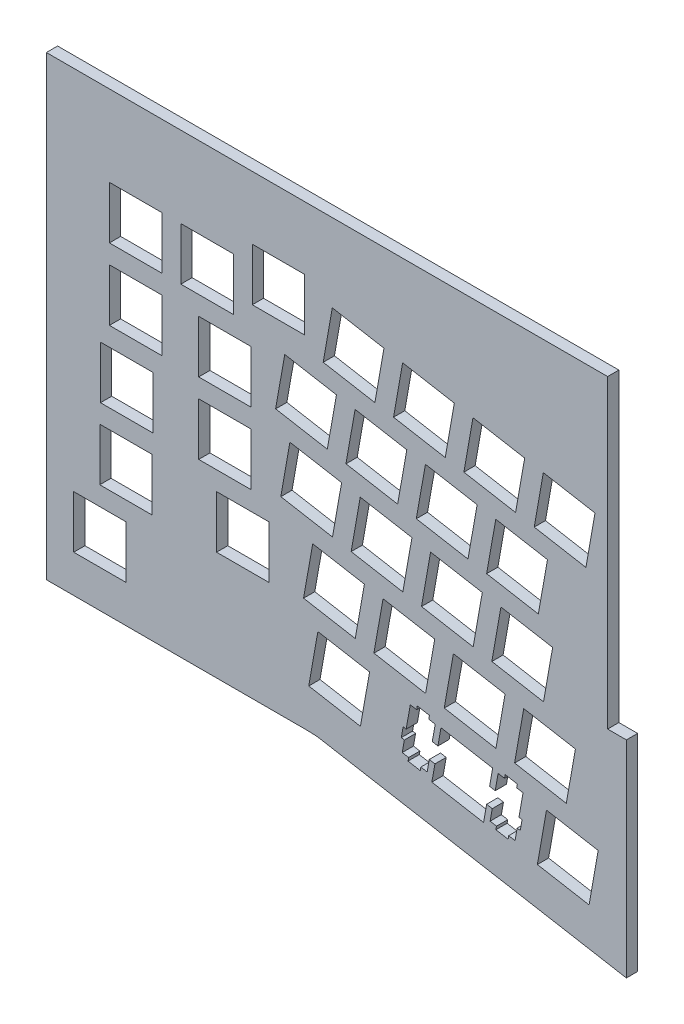
from build123d import *

# Parameters (mm, degrees)
RESSALTO_EXTRUS_O1_OUTLINE_W    = 385.763002014
RESSALTO_EXTRUS_O1_OUTLINE_H    = 172.784175795
RESSALTO_EXTRUS_O1_OUTLINE_W_2  = 13.999553143
RESSALTO_EXTRUS_O1_OUTLINE_H_2  = 14.000893144
RESSALTO_EXTRUS_O1_OUTLINE_W_3  = 13.999543143
RESSALTO_EXTRUS_O1_OUTLINE_H_3  = 14.000703143
RESSALTO_EXTRUS_O1_OUTLINE_W_4  = 13.998003143
RESSALTO_EXTRUS_O1_OUTLINE_W_5  = 14.000003143
RESSALTO_EXTRUS_O1_OUTLINE_W_6  = 14.000003144
RESSALTO_EXTRUS_O1_OUTLINE_W_7  = 13.999503143
RESSALTO_EXTRUS_O1_OUTLINE_H_4  = 13.999303143
RESSALTO_EXTRUS_O1_OUTLINE_H_5  = 13.999103143
RESSALTO_EXTRUS_O1_OUTLINE_W_8  = 13.999303144
RESSALTO_EXTRUS_O1_OUTLINE_W_9  = 13.999303143
RESSALTO_EXTRUS_O1_OUTLINE_W_10 = 13.999403143
RESSALTO_EXTRUS_O1_OUTLINE_H_6  = 13.999003143
RESSALTO_EXTRUS_O1_OUTLINE_H_7  = 14.000003143
RESSALTO_EXTRUS_O1_OUTLINE_W_11 = 14.001003144
RESSALTO_EXTRUS_O1_OUTLINE_W_12 = 13.999003143
RESSALTO_EXTRUS_O1_OUTLINE_H_8  = 14.000003144
RESSALTO_EXTRUS_O1_OUTLINE_W_13 = 13.999003144
RESSALTO_EXTRUS_O1_DEPTH        = 3
CORTE_EXTRUS_O1_DEPTH           = 3
CORTE_EXTRUS_O2_DEPTH           = 3


# Read off the part's stored shape, not the designer's step: Ressalto-extrusão1
with BuildPart() as part:
    # Ressalto-extrusão1 outline → Ressalto-extrusão1 (new body)
    with BuildSketch(Plane.XY):
        with Locations((-32.928151592, -125.295959232)):
            Rectangle(RESSALTO_EXTRUS_O1_OUTLINE_W, RESSALTO_EXTRUS_O1_OUTLINE_H)
        with Locations((-216.285310061, -202.161652991)):
            Rectangle(RESSALTO_EXTRUS_O1_OUTLINE_W_2, RESSALTO_EXTRUS_O1_OUTLINE_H_2, mode=Mode.SUBTRACT)
        with Locations((-211.522803992, -143.677644859)):
            Rectangle(RESSALTO_EXTRUS_O1_OUTLINE_W_3, RESSALTO_EXTRUS_O1_OUTLINE_H_3, mode=Mode.SUBTRACT)
        Polygon((-142.042718391, -152.663796877), (-155.830021487, -150.233196332), (-153.399320941, -136.447293236), (-139.610717845, -138.877993782), align=None, mode=Mode.SUBTRACT)
        Polygon((-124.664714489, -136.385193222), (-138.451817585, -133.954192677), (-136.020817039, -120.166989581), (-122.233713943, -122.597990127), align=None, mode=Mode.SUBTRACT)
        Polygon((-128.757115408, -141.024994264), (-127.058115027, -141.324094331), (-126.888414988, -140.359294115), (-123.637714259, -140.932494243), (-123.808714297, -141.89739446), (-122.109713916, -142.197594527), (-122.88671409, -146.599195516), (-121.384713753, -146.865195575), (-120.56871357, -142.234994536), (-106.779710474, -144.666995082), (-107.595710657, -149.295796121), (-106.09571032, -149.560396181), (-105.317710145, -145.157795192), (-103.620709764, -145.457995259), (-103.449709726, -144.492095043), (-100.199708996, -145.065295171), (-100.369709034, -146.030195388), (-98.671708653, -146.330395455), (-99.760708898, -152.503996841), (-98.947708715, -152.648596874), (-99.433708824, -155.404897493), (-100.245709006, -155.262697461), (-100.807709133, -158.443398175), (-102.506709514, -158.143198108), (-102.66570955, -159.049798311), (-105.914710279, -158.476498182), (-105.756710244, -157.570897979), (-107.453710625, -157.272097912), (-106.893710499, -154.090097198), (-108.394710836, -153.825497138), (-109.210711019, -158.452898177), (-122.999714115, -156.022197631), (-122.182713932, -151.394896592), (-123.684714269, -151.130296533), (-124.245714395, -154.310597247), (-125.944414777, -154.01039718), (-126.104614812, -154.916997383), (-129.353715542, -154.343697255), (-129.193815506, -153.437097051), (-130.893215888, -153.137896984), (-130.332315762, -149.95729627), (-131.144015944, -149.814096237), (-130.658915835, -147.056795618), (-129.845815652, -147.199995651), align=None, mode=Mode.SUBTRACT)
        Polygon((-81.071704701, -163.415399291), (-94.858707797, -160.984398746), (-92.426707251, -147.19719565), (-78.639704155, -149.628196196), align=None, mode=Mode.SUBTRACT)
        Polygon((-25.135692142, -144.336495008), (-25.293692178, -143.430894804), (-22.044691448, -142.857594676), (-21.884691412, -143.763194879), (-20.185691031, -143.464094812), (-19.624690905, -146.644695526), (-18.813690723, -146.501495494), (-18.326690613, -149.258796113), (-19.139690796, -149.401996145), (-18.049690551, -155.576997531), (-19.748690933, -155.876197599), (-19.579690895, -156.842097815), (-22.828691624, -157.413997944), (-22.999691663, -156.449497727), (-24.698692044, -156.748297794), (-25.474692218, -152.346996806), (-26.976692556, -152.611596866), (-26.160692372, -157.240397905), (-39.946695468, -159.671398451), (-40.763695651, -155.042197411), (-42.264695988, -155.306797471), (-41.488695814, -159.709798459), (-43.187696195, -160.008998527), (-43.016696157, -160.974898743), (-46.267696887, -161.548198872), (-46.436696925, -160.582298655), (-48.136697307, -160.881098722), (-49.224697551, -154.707397336), (-50.036697733, -154.850697368), (-50.524697843, -152.091996749), (-49.71169766, -151.950096717), (-50.272697786, -148.768096003), (-48.572697404, -148.469295936), (-48.73269744, -147.563695732), (-45.483696711, -146.990395603), (-45.323696675, -147.895995807), (-43.624696294, -147.59689574), (-43.063696168, -150.777496454), (-41.56169583, -150.512896394), (-42.377696014, -145.884095355), (-28.591692918, -143.453094809), (-27.775692735, -148.081895849), (-26.273692398, -147.815895789), (-26.834692524, -144.635295075), align=None, mode=Mode.SUBTRACT)
        Polygon((-105.903710277, -139.693893965), (-119.690713372, -137.262893419), (-117.259712827, -123.474290324), (-103.472709731, -125.90669087), align=None, mode=Mode.SUBTRACT)
        Polygon((-87.142706064, -143.001194708), (-100.93070916, -140.570194162), (-98.499708614, -126.782991066), (-84.712705519, -129.213991612), align=None, mode=Mode.SUBTRACT)
        Polygon((-50.356697805, -141.775994433), (-52.786698351, -127.988791337), (-38.999695255, -125.557790791), (-36.569694709, -139.344993887), align=None, mode=Mode.SUBTRACT)
        with Locations((150.428347277, -202.161652991)):
            Rectangle(RESSALTO_EXTRUS_O1_OUTLINE_W_4, RESSALTO_EXTRUS_O1_OUTLINE_H_2, mode=Mode.SUBTRACT)
        Polygon((-1.019686728, -152.80739691), (-3.450687273, -139.019793814), (10.338315823, -136.589093268), (12.769316368, -150.376396364), align=None, mode=Mode.SUBTRACT)
        Polygon((-31.595693593, -138.46869369), (-34.026694139, -124.680090594), (-20.239691043, -122.249090048), (-17.808690497, -136.036293144), align=None, mode=Mode.SUBTRACT)
        Polygon((-12.83468938, -135.159992947), (-15.265689926, -121.372789852), (-1.478686831, -118.941789306), (0.952313715, -132.727992401), align=None, mode=Mode.SUBTRACT)
        with Locations((74.227330168, -143.677644859)):
            Rectangle(RESSALTO_EXTRUS_O1_OUTLINE_W_5, RESSALTO_EXTRUS_O1_OUTLINE_H_3, mode=Mode.SUBTRACT)
        with Locations((93.277334445, -143.677644859)):
            Rectangle(RESSALTO_EXTRUS_O1_OUTLINE_W_5, RESSALTO_EXTRUS_O1_OUTLINE_H_3, mode=Mode.SUBTRACT)
        with Locations((112.327338722, -143.677644859)):
            Rectangle(RESSALTO_EXTRUS_O1_OUTLINE_W_6, RESSALTO_EXTRUS_O1_OUTLINE_H_3, mode=Mode.SUBTRACT)
        with Locations((-204.570682431, -124.628340583)):
            Rectangle(RESSALTO_EXTRUS_O1_OUTLINE_W_7, RESSALTO_EXTRUS_O1_OUTLINE_H_4, mode=Mode.SUBTRACT)
        with Locations((-204.379082388, -105.578436306)):
            Rectangle(RESSALTO_EXTRUS_O1_OUTLINE_W_7, RESSALTO_EXTRUS_O1_OUTLINE_H_5, mode=Mode.SUBTRACT)
        with Locations((-178.185376506, -105.578436306)):
            Rectangle(RESSALTO_EXTRUS_O1_OUTLINE_W_8, RESSALTO_EXTRUS_O1_OUTLINE_H_5, mode=Mode.SUBTRACT)
        with Locations((-173.422875437, -124.628340583)):
            Rectangle(RESSALTO_EXTRUS_O1_OUTLINE_W_9, RESSALTO_EXTRUS_O1_OUTLINE_H_4, mode=Mode.SUBTRACT)
        Polygon((-143.424918701, -133.07789248), (-157.212221797, -130.646891934), (-154.781521251, -116.859688838), (-140.994318156, -119.290689384), align=None, mode=Mode.SUBTRACT)
        Polygon((-149.496620065, -112.662287896), (-163.28382316, -110.23088735), (-160.853222614, -96.443884254), (-147.065919519, -98.8748848), align=None, mode=Mode.SUBTRACT)
        Polygon((-130.735815852, -115.970988639), (-144.524518948, -113.539988093), (-142.093918403, -99.752884997), (-128.305215307, -102.183885543), align=None, mode=Mode.SUBTRACT)
        with Locations((-201.997831853, -86.528382029)):
            Rectangle(RESSALTO_EXTRUS_O1_OUTLINE_W_10, RESSALTO_EXTRUS_O1_OUTLINE_H_6, mode=Mode.SUBTRACT)
        with Locations((-178.185376506, -86.528382029)):
            Rectangle(RESSALTO_EXTRUS_O1_OUTLINE_W_8, RESSALTO_EXTRUS_O1_OUTLINE_H_6, mode=Mode.SUBTRACT)
        Polygon((-150.878720375, -93.075883498), (-164.666023471, -90.643882952), (-162.235422925, -76.856879857), (-148.447819829, -79.287880402), align=None, mode=Mode.SUBTRACT)
        Polygon((-132.118016163, -96.383884241), (-145.906719259, -93.952883695), (-143.474618713, -80.163880599), (-129.687415617, -82.595881145), align=None, mode=Mode.SUBTRACT)
        Polygon((-111.97671164, -119.278289381), (-125.762714736, -116.847288836), (-123.33171419, -103.05988574), (-109.544711094, -105.490886286), align=None, mode=Mode.SUBTRACT)
        Polygon((-93.214707428, -122.586690124), (-107.001710523, -120.155989578), (-104.570709978, -106.368886483), (-90.783706882, -108.799887029), align=None, mode=Mode.SUBTRACT)
        Polygon((-58.354699601, -123.842190406), (-60.785700147, -110.05488731), (-46.997697051, -107.623886765), (-44.567696505, -121.41118986), align=None, mode=Mode.SUBTRACT)
        Polygon((-39.593695388, -120.534889664), (-42.024695934, -106.747886568), (-28.237692839, -104.316886022), (-25.806692293, -118.103889118), align=None, mode=Mode.SUBTRACT)
        Polygon((-94.596707738, -102.998885726), (-108.385710834, -100.568885181), (-105.953710288, -86.779882085), (-92.165707192, -89.211882631), align=None, mode=Mode.SUBTRACT)
        Polygon((-113.35771195, -99.691884984), (-127.144915046, -97.259884438), (-124.7137145, -83.472881342), (-110.926711405, -85.903881888), align=None, mode=Mode.SUBTRACT)
        Polygon((-66.352701397, -105.90888638), (-68.783701942, -92.120883284), (-54.996698847, -89.689882738), (-52.565698301, -103.477885834), align=None, mode=Mode.SUBTRACT)
        Polygon((-47.591697184, -102.600885637), (-50.02269773, -88.813882541), (-36.235694634, -86.382881995), (-33.804694089, -100.168885091), align=None, mode=Mode.SUBTRACT)
        with Locations((-201.997831853, -67.478377751)):
            Rectangle(RESSALTO_EXTRUS_O1_OUTLINE_W_10, RESSALTO_EXTRUS_O1_OUTLINE_H_6, mode=Mode.SUBTRACT)
        with Locations((-182.947877576, -67.478377751)):
            Rectangle(RESSALTO_EXTRUS_O1_OUTLINE_W_9, RESSALTO_EXTRUS_O1_OUTLINE_H_6, mode=Mode.SUBTRACT)
        with Locations((-163.897873298, -62.715876682)):
            Rectangle(RESSALTO_EXTRUS_O1_OUTLINE_W_8, RESSALTO_EXTRUS_O1_OUTLINE_H_7, mode=Mode.SUBTRACT)
        Polygon((-138.191117526, -75.968879657), (-151.978420622, -73.536879111), (-149.547720076, -59.750876016), (-135.76051698, -62.181876562), align=None, mode=Mode.SUBTRACT)
        Polygon((-100.671709102, -82.584881143), (-114.457712197, -80.152880597), (-112.026711652, -66.366877501), (-98.237708556, -68.797878047), align=None, mode=Mode.SUBTRACT)
        Polygon((-81.90970489, -85.892881885), (-95.696707985, -83.46188134), (-93.265707439, -69.673878244), (-79.478704344, -72.10487879), align=None, mode=Mode.SUBTRACT)
        Polygon((-119.430713314, -79.2768804), (-133.21801641, -76.845879854), (-130.785615864, -63.057876758), (-116.999712768, -65.488877304), align=None, mode=Mode.SUBTRACT)
        Polygon((-60.279700033, -85.493881796), (-62.710700579, -71.7068787), (-48.924697484, -69.275878154), (-46.493696938, -83.06288125), align=None, mode=Mode.SUBTRACT)
        Polygon((-41.520695821, -82.186881053), (-43.951696367, -68.397877957), (-30.162693271, -65.966877412), (-27.731692725, -79.755880508), align=None, mode=Mode.SUBTRACT)
        Polygon((5.925314832, -131.852692205), (3.493314286, -118.064089109), (17.282317382, -115.633388563), (19.712317927, -129.420691659), align=None, mode=Mode.SUBTRACT)
        Polygon((-20.833691176, -117.226188921), (-23.264691722, -103.438885825), (-9.476688626, -101.007885279), (-7.045688081, -114.795588375), align=None, mode=Mode.SUBTRACT)
        Polygon((-2.072686964, -113.918888178), (-4.50368751, -100.131885083), (9.283315586, -97.700884537), (11.714316132, -111.487887632), align=None, mode=Mode.SUBTRACT)
        with Locations((36.888821784, -124.628340583)):
            Rectangle(RESSALTO_EXTRUS_O1_OUTLINE_W_11, RESSALTO_EXTRUS_O1_OUTLINE_H_4, mode=Mode.SUBTRACT)
        with Locations((62.320827495, -124.628340583)):
            Rectangle(RESSALTO_EXTRUS_O1_OUTLINE_W_12, RESSALTO_EXTRUS_O1_OUTLINE_H_4, mode=Mode.SUBTRACT)
        with Locations((31.364820544, -105.578436306)):
            Rectangle(RESSALTO_EXTRUS_O1_OUTLINE_W_12, RESSALTO_EXTRUS_O1_OUTLINE_H_5, mode=Mode.SUBTRACT)
        with Locations((50.414824821, -105.578436306)):
            Rectangle(RESSALTO_EXTRUS_O1_OUTLINE_W_12, RESSALTO_EXTRUS_O1_OUTLINE_H_5, mode=Mode.SUBTRACT)
        Polygon((-28.831692972, -99.290884894), (-31.262693518, -85.504881798), (-17.474690422, -83.074881253), (-15.043689876, -96.861884348), align=None, mode=Mode.SUBTRACT)
        Polygon((-10.07068876, -95.983884151), (-12.501689306, -82.197881056), (1.28431379, -79.76688051), (3.716314336, -93.552883605), align=None, mode=Mode.SUBTRACT)
        Polygon((8.689315452, -92.676883409), (6.259314907, -78.888880313), (20.046318002, -76.458879767), (22.477318548, -90.245882863), align=None, mode=Mode.SUBTRACT)
        with Locations((36.127321613, -86.528382029)):
            Rectangle(RESSALTO_EXTRUS_O1_OUTLINE_W_6, RESSALTO_EXTRUS_O1_OUTLINE_H_6, mode=Mode.SUBTRACT)
        with Locations((55.17732589, -86.528382029)):
            Rectangle(RESSALTO_EXTRUS_O1_OUTLINE_W_6, RESSALTO_EXTRUS_O1_OUTLINE_H_6, mode=Mode.SUBTRACT)
        with Locations((93.277334445, -124.628340583)):
            Rectangle(RESSALTO_EXTRUS_O1_OUTLINE_W_5, RESSALTO_EXTRUS_O1_OUTLINE_H_4, mode=Mode.SUBTRACT)
        Polygon((74.3713302, -103.278885789), (74.3713302, -98.578884734), (88.370333343, -98.578884734), (88.370333343, -103.278885789), (89.896333686, -103.278885789), (89.896333686, -100.048885064), (91.621334073, -100.048885064), (91.621334073, -99.126884857), (94.920334814, -99.126884857), (94.920334814, -100.048885064), (96.645335201, -100.048885064), (96.645335201, -103.278885789), (97.471335386, -103.278885789), (97.471335386, -106.077886418), (96.645335201, -106.077886418), (96.645335201, -112.347987825), (94.920334814, -112.347987825), (94.920334814, -113.329088046), (91.621334073, -113.329088046), (91.621334073, -112.347987825), (89.896333686, -112.347987825), (89.896333686, -107.878886822), (88.370333343, -107.878886822), (88.370333343, -112.577987877), (74.3713302, -112.577987877), (74.3713302, -107.878886822), (72.846329857, -107.878886822), (72.846329857, -112.347987825), (71.12032947, -112.347987825), (71.12032947, -113.329088046), (67.821328729, -113.329088046), (67.821328729, -112.347987825), (66.096328342, -112.347987825), (66.096328342, -106.077886418), (65.270328156, -106.077886418), (65.270328156, -103.278885789), (66.096328342, -103.278885789), (66.096328342, -100.048885064), (67.821328729, -100.048885064), (67.821328729, -99.126884857), (71.12032947, -99.126884857), (71.12032947, -100.048885064), (72.846329857, -100.048885064), (72.846329857, -103.278885789), align=None, mode=Mode.SUBTRACT)
        with Locations((78.989831237, -86.528382029)):
            Rectangle(RESSALTO_EXTRUS_O1_OUTLINE_W_12, RESSALTO_EXTRUS_O1_OUTLINE_H_6, mode=Mode.SUBTRACT)
        with Locations((121.852340861, -100.815885236)):
            Rectangle(RESSALTO_EXTRUS_O1_OUTLINE_W_5, RESSALTO_EXTRUS_O1_OUTLINE_H_8, mode=Mode.SUBTRACT)
        Polygon((-22.759691609, -78.87788031), (-25.190692155, -65.090877215), (-11.403689059, -62.659876669), (-8.972688513, -76.446879765), align=None, mode=Mode.SUBTRACT)
        Polygon((-3.997687396, -75.570879568), (-6.429687942, -61.781876472), (7.357315153, -59.350875926), (9.789315699, -73.139879022), align=None, mode=Mode.SUBTRACT)
        with Locations((21.839818405, -62.715876682)):
            Rectangle(RESSALTO_EXTRUS_O1_OUTLINE_W_13, RESSALTO_EXTRUS_O1_OUTLINE_H_7, mode=Mode.SUBTRACT)
        with Locations((40.889822682, -67.478377751)):
            Rectangle(RESSALTO_EXTRUS_O1_OUTLINE_W_12, RESSALTO_EXTRUS_O1_OUTLINE_H_6, mode=Mode.SUBTRACT)
        with Locations((59.93982696, -67.478377751)):
            Rectangle(RESSALTO_EXTRUS_O1_OUTLINE_W_12, RESSALTO_EXTRUS_O1_OUTLINE_H_6, mode=Mode.SUBTRACT)
        with Locations((78.989831237, -67.478377751)):
            Rectangle(RESSALTO_EXTRUS_O1_OUTLINE_W_12, RESSALTO_EXTRUS_O1_OUTLINE_H_6, mode=Mode.SUBTRACT)
        with Locations((117.089839791, -81.765880959)):
            Rectangle(RESSALTO_EXTRUS_O1_OUTLINE_W_12, RESSALTO_EXTRUS_O1_OUTLINE_H_8, mode=Mode.SUBTRACT)
        with Locations((112.327338722, -62.715876682)):
            Rectangle(RESSALTO_EXTRUS_O1_OUTLINE_W_6, RESSALTO_EXTRUS_O1_OUTLINE_H_7, mode=Mode.SUBTRACT)
    extrude(amount=RESSALTO_EXTRUS_O1_DEPTH)

    # Esboço2 → Corte-extrusão1 (cut)
    with BuildSketch(Plane.XY.offset(3)):
        Polygon((-225.809652599, -160.677996431), (-225.809652599, -211.68804713), (159.953349415, -211.68804713), (159.953349415, -38.903871335), (136.142342432, -38.903871335), (136.142342432, -160.677996431), (13.03442747, -160.483082346), (-71.116906176, -175.322186661), (-153.587996554, -160.784331894), (-156.132242037, -160.677996431), align=None)
    extrude(amount=-CORTE_EXTRUS_O1_DEPTH, mode=Mode.SUBTRACT)

    # Esboço3 → Corte-extrusão2 (cut)
    with BuildSketch(Plane.XY.offset(3)):
        Polygon((-71.116906176, -175.322186661), (-71.116906176, -120.322186661), (-76.116906176, -120.322186661), (-76.116906176, -38.903871335), (136.142342432, -38.903871335), (136.142342432, -160.677996431), (13.03442747, -160.483082346), align=None)
    extrude(amount=-CORTE_EXTRUS_O2_DEPTH, mode=Mode.SUBTRACT)


solid = part.part
